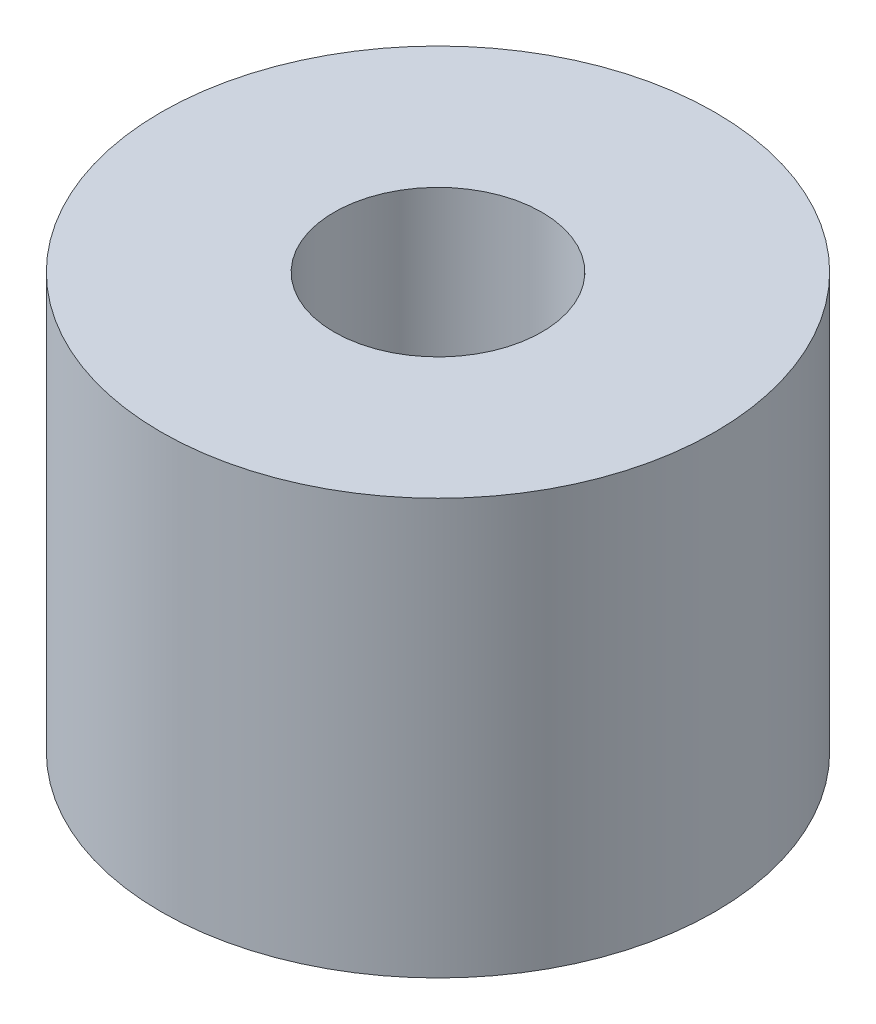
from build123d import *

# Parameters (mm, degrees)
SKETCH1_R           = 4
SKETCH1_R_2         = 1.5
BOSS_EXTRUDE1_DEPTH = 6


with BuildPart() as part:
    # Sketch1 → Boss-Extrude1 (new body)
    with BuildSketch(Plane(origin=(0, 0, 0), x_dir=(1, 0, 0), z_dir=(0, 1, 0))):
        Circle(SKETCH1_R)
        Circle(SKETCH1_R_2, mode=Mode.SUBTRACT)
    extrude(amount=BOSS_EXTRUDE1_DEPTH)


solid = part.part
